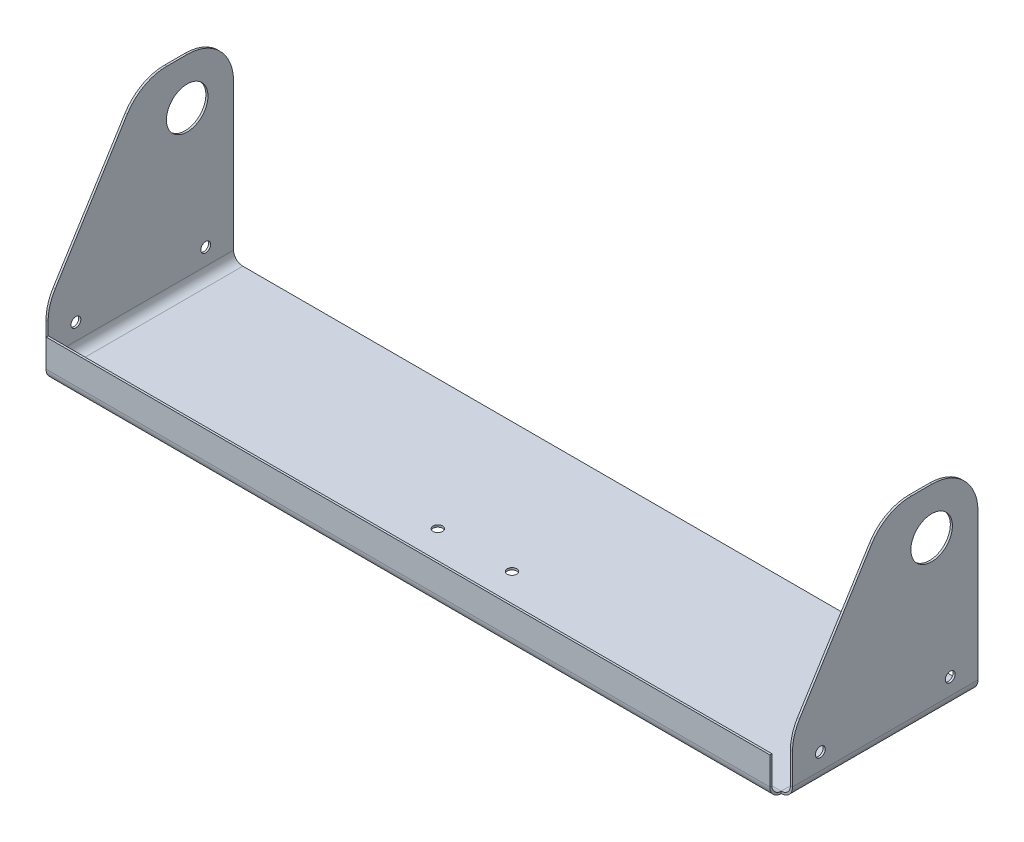
from build123d import *

# Parameters (mm, degrees)
SKETCH1_W                      = 511.175
SKETCH1_H                      = 127
BASE_FLANGE1_DEPTH             = 1.42875
EDGE_FLANGE1_STRIP_W           = 18.415
EDGE_FLANGE1_STRIP_H           = 1.42875
EDGE_FLANGE1_STRIP_CUT_DEPTH   = 127
EDGE_FLANGE1_STRIP_2_W         = 18.415
EDGE_FLANGE1_STRIP_2_H         = 1.42875
EDGE_FLANGE1_STRIP_CUT_2_DEPTH = 127
EDGE_FLANGE1_DEPTH             = 127
EDGE_FLANGE1_BEND_DEPTH        = 127
CUT_EXTRUDE1_DEPTH             = 534.339544007
FILLET1_R                      = 31.75
SKETCH14_R                     = 14.224
CUT_EXTRUDE2_DEPTH             = 534.339544007
H_0_266_DIAMETER_HOLE1_D       = 6.7564
F_0_257_DIAMETER_HOLE2_D       = 6.5278
EDGE_FLANGE2_DEPTH             = 495.6175


# Sheet-metal steps are written as plain solids
with BuildPart() as part:
    # Sketch1 → Base-Flange1 (new body)
    with BuildSketch(Plane(origin=(0, 0, 0), x_dir=(1, 0, 0), z_dir=(0, 1, 0))):
        Rectangle(SKETCH1_W, SKETCH1_H)
    extrude(amount=-BASE_FLANGE1_DEPTH)

    # Edge-Flange1 strip (across the edge) → Edge-Flange1 strip cut (cut)
    with BuildSketch(Plane(origin=(255.5875, 0, 63.5), x_dir=(-1, 0, 0), z_dir=(0, 0, -1))):
        with Locations((-1.42875, -0.714375)):
            Rectangle(EDGE_FLANGE1_STRIP_W, EDGE_FLANGE1_STRIP_H)
    extrude(amount=EDGE_FLANGE1_STRIP_CUT_DEPTH, mode=Mode.SUBTRACT)

    # Edge-Flange1 strip 2 (across the edge) → Edge-Flange1 strip cut 2 (cut)
    with BuildSketch(Plane(origin=(-255.5875, 0, -63.5), x_dir=(1, 0, 0), z_dir=(0, 0, 1))):
        with Locations((-1.42875, -0.714375)):
            Rectangle(EDGE_FLANGE1_STRIP_2_W, EDGE_FLANGE1_STRIP_2_H)
    extrude(amount=EDGE_FLANGE1_STRIP_CUT_2_DEPTH, mode=Mode.SUBTRACT)

    # Edge-Flange1 section (across the edge) → Edge-Flange1 (add)
    with BuildSketch(Plane(origin=(255.5875, 0, 63.5), x_dir=(-1, 0, 0), z_dir=(0, 0, -1))):
        with BuildLine():
            Line((0, 6.35), (0, 138.27125))
            Line((0, 138.27125), (1.42875, 138.27125))
            Line((1.42875, 138.27125), (1.42875, 6.35))
            ThreePointArc((1.42875, 6.35), (3.288621939, 1.859871939), (7.77875, 0))
            Line((7.77875, 0), (7.77875, -1.42875))
            ThreePointArc((7.77875, -1.42875), (2.278343126, 0.849593126), (0, 6.35))
        make_face()
    extrude(amount=EDGE_FLANGE1_DEPTH)

    # Edge-Flange1 section 2 (across the edge) → Edge-Flange1 bend (add)
    with BuildSketch(Plane(origin=(-255.5875, 0, -63.5), x_dir=(1, 0, 0), z_dir=(0, 0, 1))):
        with BuildLine():
            Line((0, 6.35), (0, 138.27125))
            Line((0, 138.27125), (1.42875, 138.27125))
            Line((1.42875, 138.27125), (1.42875, 6.35))
            ThreePointArc((1.42875, 6.35), (3.288621939, 1.859871939), (7.77875, 0))
            Line((7.77875, 0), (7.77875, -1.42875))
            ThreePointArc((7.77875, -1.42875), (2.278343126, 0.849593126), (0, 6.35))
        make_face()
    extrude(amount=EDGE_FLANGE1_BEND_DEPTH)

    # Sketch13 → Cut-Extrude1 (cut, through all)
    with BuildSketch(Plane(origin=(255.5875, 0, 0), x_dir=(0, 0, -1), z_dir=(1, 0, 0))):
        Polygon((-63.5, 36.67125), (0, 138.27125), (-63.5, 138.27125), align=None)
    extrude(amount=-CUT_EXTRUDE1_DEPTH, mode=Mode.SUBTRACT)

    # Fillet1
    fillet1_edges = [part.edges().sort_by_distance(p)[0] for p in [
        (254.873125, 138.27125, -63.5),
        (-254.873125, 138.27125, -63.5),
        (254.873125, 138.27125, 0),
        (254.873125, 36.67125, 63.5),
        (-254.873125, 138.27125, 0),
        (-254.873125, 36.67125, 63.5),
    ]]
    fillet(fillet1_edges, radius=FILLET1_R)

    # Sketch14 → Cut-Extrude2 (cut, through all)
    with BuildSketch(Plane(origin=(255.5875, 0, 0), x_dir=(0, 0, -1), z_dir=(1, 0, 0))):
        with Locations(Location((31.75, 106.52125, 0), (0, 0, 90))):
            Circle(SKETCH14_R)
    extrude(amount=-CUT_EXTRUDE2_DEPTH, mode=Mode.SUBTRACT)

    # H (0.266) Diameter Hole1 (through all)
    with Locations(Plane(origin=(255.5875, 0, 0), x_dir=(0, 0, -1), z_dir=(1, 0, 0))):
        with Locations((-44.45, 17.62125), (44.45, 17.62125)):
            Hole(H_0_266_DIAMETER_HOLE1_D / 2)

    # F (0.257) Diameter Hole2 (through all)
    with Locations(Plane(origin=(0, 0, 0), x_dir=(1, 0, 0), z_dir=(0, 1, 0))):
        with Locations((-25.4, -25.4), (25.4, -25.4)):
            Hole(F_0_257_DIAMETER_HOLE2_D / 2)

    # Edge-Flange2 section (across the edge) → Edge-Flange2 (add)
    with BuildSketch(Plane(origin=(-247.80875, 0, 69.85), x_dir=(0, 0, -1), z_dir=(1, 0, 0))):
        with BuildLine():
            Line((-1.42875, 6.35), (-1.42875, 25.4))
            Line((-1.42875, 25.4), (0, 25.4))
            Line((0, 25.4), (0, 6.35))
            ThreePointArc((0, 6.35), (1.859871939, 1.859871939), (6.35, 0))
            Line((6.35, 0), (6.35, -1.42875))
            ThreePointArc((6.35, -1.42875), (0.849593126, 0.849593126), (-1.42875, 6.35))
        make_face()
    extrude(amount=EDGE_FLANGE2_DEPTH)


solid = part.part
